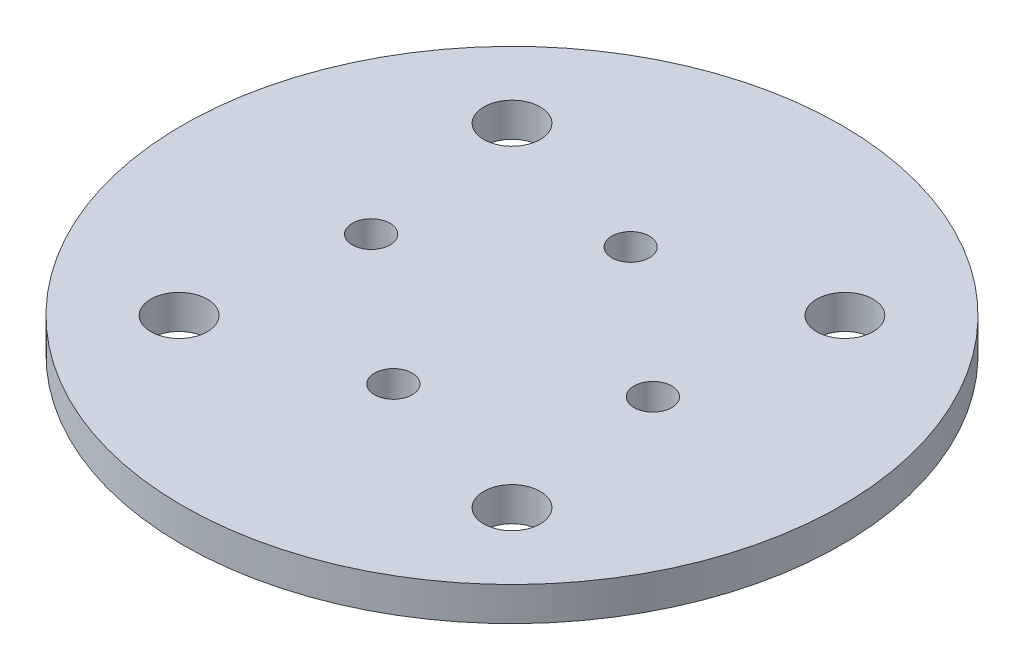
from build123d import *

# Parameters (mm, degrees)
SKETCH1_R           = 22.225
SKETCH1_R_2         = 1.27
SKETCH1_R_3         = 1.905
BOSS_EXTRUDE1_DEPTH = 1.143


with BuildPart() as part:
    # Sketch1 → Boss-Extrude1 (new, symmetric)
    with BuildSketch(Plane(origin=(0, 0, 0), x_dir=(1, 0, 0), z_dir=(0, 1, 0))):
        Circle(SKETCH1_R)
        with Locations((0, 8)):
            Circle(SKETCH1_R_2, mode=Mode.SUBTRACT)
        with Locations((9.5, 0)):
            Circle(SKETCH1_R_2, mode=Mode.SUBTRACT)
        with Locations((0, -8)):
            Circle(SKETCH1_R_2, mode=Mode.SUBTRACT)
        with Locations((-9.5, 0)):
            Circle(SKETCH1_R_2, mode=Mode.SUBTRACT)
        with Locations((-11.225320151, -11.225320151)):
            Circle(SKETCH1_R_3, mode=Mode.SUBTRACT)
        with Locations((11.225320151, -11.225320151)):
            Circle(SKETCH1_R_3, mode=Mode.SUBTRACT)
        with Locations((11.225320151, 11.225320151)):
            Circle(SKETCH1_R_3, mode=Mode.SUBTRACT)
        with Locations((-11.225320151, 11.225320151)):
            Circle(SKETCH1_R_3, mode=Mode.SUBTRACT)
    extrude(amount=BOSS_EXTRUDE1_DEPTH, both=True)


solid = part.part
